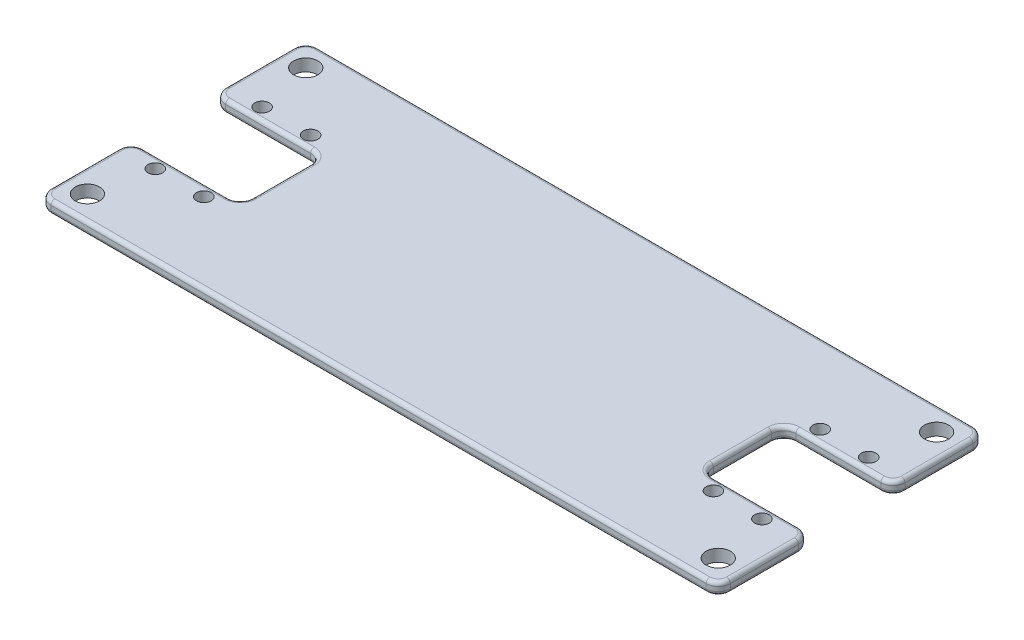
from build123d import *

# Parameters (mm, degrees)
SKETCH1_W           = 177.8
SKETCH1_H           = 69.85
BOSS_EXTRUDE1_DEPTH = 3.175
SKETCH2_R           = 3.175
SKETCH2_R_2         = 1.905
SKETCH2_W           = 28.575
SKETCH2_H           = 21.59
CUT_EXTRUDE1_DEPTH  = 96.56697259
FILLET1_R           = 3.175
FILLET2_R           = 1.000000032


with BuildPart() as part:
    # Sketch1 → Boss-Extrude1 (new body)
    with BuildSketch(Plane(origin=(0, 0, 0), x_dir=(1, 0, 0), z_dir=(0, 1, 0))):
        Rectangle(SKETCH1_W, SKETCH1_H)
    extrude(amount=BOSS_EXTRUDE1_DEPTH)

    # Sketch2 → Cut-Extrude1 (cut, through all)
    with BuildSketch(Plane(origin=(0, 3.175, 0), x_dir=(1, 0, 0), z_dir=(0, 1, 0))):
        with Locations((-82.55, 28.575)):
            Circle(SKETCH2_R)
        with Locations((-82.55, -28.575)):
            Circle(SKETCH2_R)
        with Locations((82.55, 28.575)):
            Circle(SKETCH2_R)
        with Locations((82.55, -28.575)):
            Circle(SKETCH2_R)
        with Locations((-66.675, 13.97)):
            Circle(SKETCH2_R_2)
        with Locations((-79.375, 13.97)):
            Circle(SKETCH2_R_2)
        with Locations((-66.675, -13.97)):
            Circle(SKETCH2_R_2)
        with Locations((-79.375, -13.97)):
            Circle(SKETCH2_R_2)
        with Locations((66.675, 13.97)):
            Circle(SKETCH2_R_2)
        with Locations((79.375, 13.97)):
            Circle(SKETCH2_R_2)
        with Locations((66.675, -13.97)):
            Circle(SKETCH2_R_2)
        with Locations((79.375, -13.97)):
            Circle(SKETCH2_R_2)
        with Locations((-74.6125, 0)):
            Rectangle(SKETCH2_W, SKETCH2_H)
        with Locations((74.6125, 0)):
            Rectangle(SKETCH2_W, SKETCH2_H)
    extrude(amount=-CUT_EXTRUDE1_DEPTH, mode=Mode.SUBTRACT)

    # Fillet1
    fillet1_edges = [part.edges().sort_by_distance(p)[0] for p in [
        (88.9, 1.5875, -34.925),
        (88.9, 1.5875, 34.925),
        (-88.9, 1.5875, -34.925),
        (-88.9, 1.5875, 34.925),
        (88.9, 1.5875, 10.795),
        (60.325, 1.5875, 10.795),
        (60.325, 1.5875, -10.795),
        (88.9, 1.5875, -10.795),
        (-88.9, 1.5875, 10.795),
        (-60.325, 1.5875, 10.795),
        (-60.325, 1.5875, -10.795),
        (-88.9, 1.5875, -10.795),
    ]]
    fillet(fillet1_edges, radius=FILLET1_R)

    # Fillet2
    fillet2_edges = [part.edges().sort_by_distance(p)[0] for p in [
        (-87.97006403, 0, 33.99506403),
        (-88.9, 0, 22.86),
        (-87.97006403, 0, 11.72493597),
        (-74.6125, 0, 10.795),
        (-61.25493597, 0, 9.86506403),
        (-60.325, 0, 0),
        (-61.25493597, 0, -9.86506403),
        (-74.6125, 0, -10.795),
        (-87.97006403, 0, -11.72493597),
        (-88.9, 0, -22.86),
        (-87.97006403, 0, -33.99506403),
        (0, 0, -34.925),
        (87.97006403, 0, -33.99506403),
        (88.9, 0, -22.86),
        (87.97006403, 0, -11.72493597),
        (74.6125, 0, -10.795),
        (61.25493597, 0, -9.86506403),
        (60.325, 0, 0),
        (61.25493597, 0, 9.86506403),
        (74.6125, 0, 10.795),
        (87.97006403, 0, 11.72493597),
        (88.9, 0, 22.86),
        (87.97006403, 0, 33.99506403),
        (-87.97006403, 3.175, 33.99506403),
        (-88.9, 3.175, 22.86),
        (-87.97006403, 3.175, 11.72493597),
        (-74.6125, 3.175, 10.795),
        (-61.25493597, 3.175, 9.86506403),
        (-60.325, 3.175, 0),
        (-61.25493597, 3.175, -9.86506403),
        (-74.6125, 3.175, -10.795),
        (-87.97006403, 3.175, -11.72493597),
        (-88.9, 3.175, -22.86),
        (-87.97006403, 3.175, -33.99506403),
        (0, 3.175, -34.925),
        (87.97006403, 3.175, -33.99506403),
        (88.9, 3.175, -22.86),
        (87.97006403, 3.175, -11.72493597),
        (74.6125, 3.175, -10.795),
        (61.25493597, 3.175, -9.86506403),
        (60.325, 3.175, 0),
        (61.25493597, 3.175, 9.86506403),
        (74.6125, 3.175, 10.795),
        (87.97006403, 3.175, 11.72493597),
        (88.9, 3.175, 22.86),
        (87.97006403, 3.175, 33.99506403),
        (0, 0, 34.925),
        (0, 3.175, 34.925),
    ]]
    fillet(fillet2_edges, radius=FILLET2_R)


solid = part.part
